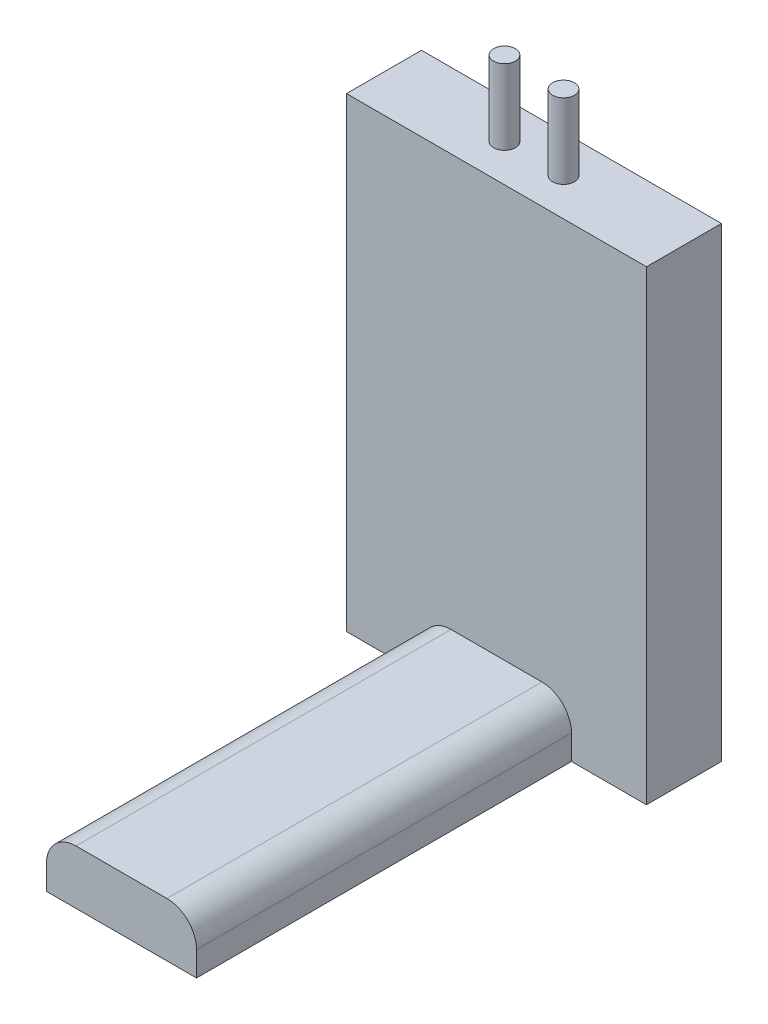
from build123d import *

# Parameters (mm, degrees)
SKETCH3_W           = 101.6
SKETCH3_H           = 25.4
BOSS_EXTRUDE1_DEPTH = 157.8
SKETCH6_R           = 3.683
BOSS_EXTRUDE4_DEPTH = 25.4
SKETCH7_R           = 5.207
CUT_EXTRUDE1_DEPTH  = 17.78
SKETCH8_W           = 50.8
SKETCH8_H           = 18.321584398
BOSS_EXTRUDE5_DEPTH = 127
FILLET1_R           = 10
FILLET2_R           = 10


with BuildPart() as part:
    # Sketch3 → Boss-Extrude1 (new body)
    with BuildSketch(Plane(origin=(0, 0, 0), x_dir=(1, 0, 0), z_dir=(0, 1, 0))):
        with Locations((25.4, 12.7)):
            Rectangle(SKETCH3_W, SKETCH3_H)
    extrude(amount=BOSS_EXTRUDE1_DEPTH)

    # Sketch6 → Boss-Extrude4 (add)
    with BuildSketch(Plane(origin=(0, 157.8, 0), x_dir=(1, 0, 0), z_dir=(0, 1, 0))):
        with Locations((15.4, 12.7)):
            Circle(SKETCH6_R)
        with Locations((35.4, 12.7)):
            Circle(SKETCH6_R)
    extrude(amount=BOSS_EXTRUDE4_DEPTH)

    # Sketch7 → Cut-Extrude1 (cut)
    with BuildSketch(Plane(origin=(0, 0, 0), x_dir=(-1, 0, 0), z_dir=(0, -1, 0))):
        with Locations((5.08, 12.7)):
            Circle(SKETCH7_R)
        with Locations((-55.88, 12.7)):
            Circle(SKETCH7_R)
    extrude(amount=-CUT_EXTRUDE1_DEPTH, mode=Mode.SUBTRACT)

    # Sketch8 → Boss-Extrude5 (add)
    with BuildSketch(Plane.XY):
        with Locations((25.4, 9.160792199)):
            Rectangle(SKETCH8_W, SKETCH8_H)
    extrude(amount=BOSS_EXTRUDE5_DEPTH)

    # Fillet1
    fillet1_edges = [part.edges().sort_by_distance(p)[0] for p in [
        (50.8, 18.321584398, 63.5),
    ]]
    fillet(fillet1_edges, radius=FILLET1_R)

    # Fillet2
    fillet2_edges = [part.edges().sort_by_distance(p)[0] for p in [
        (0, 18.321584398, 63.5),
    ]]
    fillet(fillet2_edges, radius=FILLET2_R)


solid = part.part
